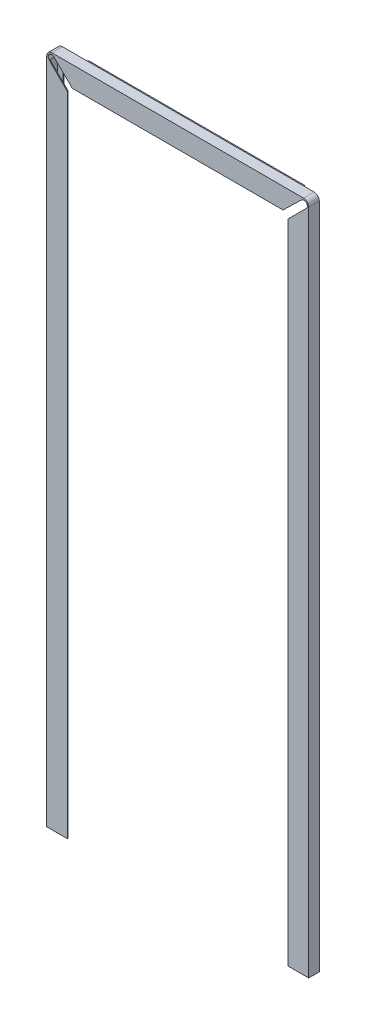
from build123d import *

# Parameters (mm, degrees)
SKETCH1_W           = 647.7
SKETCH1_H           = 1663.7
BOSS_EXTRUDE1_DEPTH = 26.162
SKETCH2_W           = 546.1
SKETCH2_H           = 1612.9
CUT_EXTRUDE1_DEPTH  = 26.162
CUT_EXTRUDE2_DEPTH  = 26.162
CUT_EXTRUDE3_DEPTH  = 24.13
FILLET1_R           = 12.7
SHELL4_START        = 1.778
SHELL4_DEPTH        = 22.606
SKETCH5_W           = 533.4
SKETCH5_H           = 2.286
BOSS_EXTRUDE3_DEPTH = 16.764
SKETCH7_R           = 3.81
CUT_EXTRUDE5_DEPTH  = 16.764


# Read off the part's stored shape, not the designer's step: Shell4
with BuildPart() as part:
    # Sketch1 → Boss-Extrude1 (new body)
    with BuildSketch(Plane.XY):
        Rectangle(SKETCH1_W, SKETCH1_H)
    extrude(amount=BOSS_EXTRUDE1_DEPTH)

    # Sketch2 → Cut-Extrude1 (cut)
    with BuildSketch(Plane.XY.offset(26.162)):
        with Locations((0, -25.4)):
            Rectangle(SKETCH2_W, SKETCH2_H)
    extrude(amount=-CUT_EXTRUDE1_DEPTH, mode=Mode.SUBTRACT)

    # Sketch3 → Cut-Extrude2 (cut)
    with BuildSketch(Plane.XY.offset(26.162)):
        with BuildLine():
            Line((-317.951280605, 813.251280605), (-273.05, 768.35))
            Line((-273.05, 768.35), (-273.05, 781.05))
            Line((-273.05, 781.05), (-260.35, 781.05))
            Line((-260.35, 781.05), (-305.950453026, 825.241047594))
            ThreePointArc((-305.950453026, 825.241047594), (-317.94851482, 825.249344949), (-317.951280605, 813.251280605))
        make_face()
        with BuildLine():
            Line((305.950453026, 825.241047594), (260.35, 781.05))
            Line((260.35, 781.05), (273.05, 781.05))
            Line((273.05, 781.05), (273.05, 768.35))
            Line((273.05, 768.35), (317.951280605, 813.251280605))
            ThreePointArc((317.951280605, 813.251280605), (317.94851482, 825.249344949), (305.950453026, 825.241047594))
        make_face()
    extrude(amount=-CUT_EXTRUDE2_DEPTH, mode=Mode.SUBTRACT)

    # Sketch4 → Cut-Extrude3 (cut)
    with BuildSketch(Plane(origin=(0, 0, 0), x_dir=(-1, 0, 0), z_dir=(0, 0, -1))):
        Polygon((-307.8988, 768.35), (-307.8988, 803.1988), (-273.05, 768.35), (-273.05, -831.85), (-307.8988, -831.85), align=None)
        Polygon((-260.35, 781.05), (-295.735951532, 815.342252918), (295.735951532, 815.342252918), (260.35, 781.05), align=None)
        Polygon((307.8988, 803.1988), (273.05, 768.35), (273.05, -831.85), (307.8988, -831.85), (307.8988, 768.35), align=None)
    extrude(amount=-CUT_EXTRUDE3_DEPTH, mode=Mode.SUBTRACT)

    # Fillet1
    fillet1_edges = [part.edges().sort_by_distance(p)[0] for p in [
        (-323.85, 831.85, 13.081),
        (323.85, 831.85, 13.081),
    ]]
    fillet(fillet1_edges, radius=FILLET1_R)

    # Shell4 outline → Shell4 (cut)
    with BuildSketch(Plane.XY.offset(SHELL4_START)):
        with BuildLine():
            Line((307.8988, 803.1988), (307.8988, -830.072))
            Line((307.8988, -830.072), (322.072, -830.072))
            Line((322.072, -830.072), (322.072, 817.550302353))
            ThreePointArc((322.072, 817.550302353), (321.07369087, 814.548798877), (319.208516462, 811.994044748))
            Line((319.208516462, 811.994044748), (317.951280605, 813.251280605))
            Line((317.951280605, 813.251280605), (307.8988, 803.1988))
        make_face()
        with BuildLine():
            Line((-322.072, -830.072), (-307.8988, -830.072))
            Line((-307.8988, -830.072), (-307.8988, 803.1988))
            Line((-307.8988, 803.1988), (-317.951280605, 813.251280605))
            Line((-317.951280605, 813.251280605), (-319.208516462, 811.994044748))
            ThreePointArc((-319.208516462, 811.994044748), (-321.07369087, 814.548798877), (-322.072, 817.550302353))
            Line((-322.072, 817.550302353), (-322.072, -830.072))
        make_face()
        with BuildLine():
            ThreePointArc((301.905011396, 821.320641288), (309.142763578, 829.116339567), (319.402097182, 826.304926702))
            ThreePointArc((319.402097182, 826.304926702), (315.685635268, 829.085698099), (311.15, 830.072))
            Line((311.15, 830.072), (-311.15, 830.072))
            ThreePointArc((-311.15, 830.072), (-315.685635267, 829.085698099), (-319.402097181, 826.304926702))
            ThreePointArc((-319.402097181, 826.304926702), (-309.142763577, 829.116339567), (-301.905011396, 821.320641288))
            Line((-301.905011396, 821.320641288), (-295.735951532, 815.342252918))
            Line((-295.735951532, 815.342252918), (295.735951532, 815.342252918))
            Line((295.735951532, 815.342252918), (301.905011396, 821.320641288))
        make_face()
    extrude(amount=SHELL4_DEPTH, mode=Mode.SUBTRACT)

    # Sketch5 → Boss-Extrude3 (add)
    with BuildSketch(Plane(origin=(0, 0, 0), x_dir=(-1, 0, 0), z_dir=(0, 0, -1))):
        with Locations((-3.635951532, 816.485252918)):
            Rectangle(SKETCH5_W, SKETCH5_H)
    extrude(amount=BOSS_EXTRUDE3_DEPTH)

    # Sketch7 → Cut-Extrude5 (cut)
    with BuildSketch(Plane(origin=(0, 817.628252918, 0), x_dir=(1, 0, 0), z_dir=(0, 1, 0))):
        with Locations(Location((-256.714048468, 8.382, 0), (0, 0, 270))):
            Circle(SKETCH7_R)
        with Locations(Location((-241.982048468, 8.382, 0), (0, 0, 270))):
            Circle(SKETCH7_R)
        with Locations(Location((-227.250048468, 8.382, 0), (0, 0, 270))):
            Circle(SKETCH7_R)
        with Locations(Location((-212.518048468, 8.382, 0), (0, 0, 270))):
            Circle(SKETCH7_R)
        with Locations(Location((-197.786048468, 8.382, 0), (0, 0, 270))):
            Circle(SKETCH7_R)
        with Locations(Location((-183.054048468, 8.382, 0), (0, 0, 270))):
            Circle(SKETCH7_R)
        with Locations(Location((-168.322048468, 8.382, 0), (0, 0, 270))):
            Circle(SKETCH7_R)
        with Locations(Location((-153.590048468, 8.382, 0), (0, 0, 270))):
            Circle(SKETCH7_R)
        with Locations(Location((-138.858048468, 8.382, 0), (0, 0, 270))):
            Circle(SKETCH7_R)
        with Locations(Location((-124.126048468, 8.382, 0), (0, 0, 270))):
            Circle(SKETCH7_R)
        with Locations(Location((-109.394048468, 8.382, 0), (0, 0, 270))):
            Circle(SKETCH7_R)
        with Locations(Location((-94.662048468, 8.382, 0), (0, 0, 270))):
            Circle(SKETCH7_R)
        with Locations(Location((-79.930048468, 8.382, 0), (0, 0, 270))):
            Circle(SKETCH7_R)
        with Locations(Location((-65.198048468, 8.382, 0), (0, 0, 270))):
            Circle(SKETCH7_R)
        with Locations(Location((-50.466048468, 8.382, 0), (0, 0, 270))):
            Circle(SKETCH7_R)
        with Locations(Location((-35.734048468, 8.382, 0), (0, 0, 270))):
            Circle(SKETCH7_R)
        with Locations(Location((-21.002048468, 8.382, 0), (0, 0, 270))):
            Circle(SKETCH7_R)
        with Locations(Location((-6.270048468, 8.382, 0), (0, 0, 270))):
            Circle(SKETCH7_R)
        with Locations(Location((8.461951532, 8.382, 0), (0, 0, 270))):
            Circle(SKETCH7_R)
        with Locations(Location((23.193951532, 8.382, 0), (0, 0, 270))):
            Circle(SKETCH7_R)
        with Locations(Location((37.925951532, 8.382, 0), (0, 0, 270))):
            Circle(SKETCH7_R)
        with Locations(Location((52.657951532, 8.382, 0), (0, 0, 270))):
            Circle(SKETCH7_R)
        with Locations(Location((67.389951532, 8.382, 0), (0, 0, 270))):
            Circle(SKETCH7_R)
        with Locations(Location((82.121951532, 8.382, 0), (0, 0, 270))):
            Circle(SKETCH7_R)
        with Locations(Location((96.853951532, 8.382, 0), (0, 0, 270))):
            Circle(SKETCH7_R)
        with Locations(Location((111.585951532, 8.382, 0), (0, 0, 270))):
            Circle(SKETCH7_R)
        with Locations(Location((126.317951532, 8.382, 0), (0, 0, 270))):
            Circle(SKETCH7_R)
        with Locations(Location((141.049951532, 8.382, 0), (0, 0, 270))):
            Circle(SKETCH7_R)
        with Locations(Location((155.781951532, 8.382, 0), (0, 0, 270))):
            Circle(SKETCH7_R)
        with Locations(Location((170.513951532, 8.382, 0), (0, 0, 270))):
            Circle(SKETCH7_R)
        with Locations(Location((185.245951532, 8.382, 0), (0, 0, 270))):
            Circle(SKETCH7_R)
        with Locations(Location((199.977951532, 8.382, 0), (0, 0, 270))):
            Circle(SKETCH7_R)
        with Locations(Location((214.709951532, 8.382, 0), (0, 0, 270))):
            Circle(SKETCH7_R)
        with Locations(Location((229.441951532, 8.382, 0), (0, 0, 270))):
            Circle(SKETCH7_R)
        with Locations(Location((244.173951532, 8.382, 0), (0, 0, 270))):
            Circle(SKETCH7_R)
        with Locations(Location((258.905951532, 8.382, 0), (0, 0, 270))):
            Circle(SKETCH7_R)
    extrude(amount=-CUT_EXTRUDE5_DEPTH, mode=Mode.SUBTRACT)


solid = part.part
